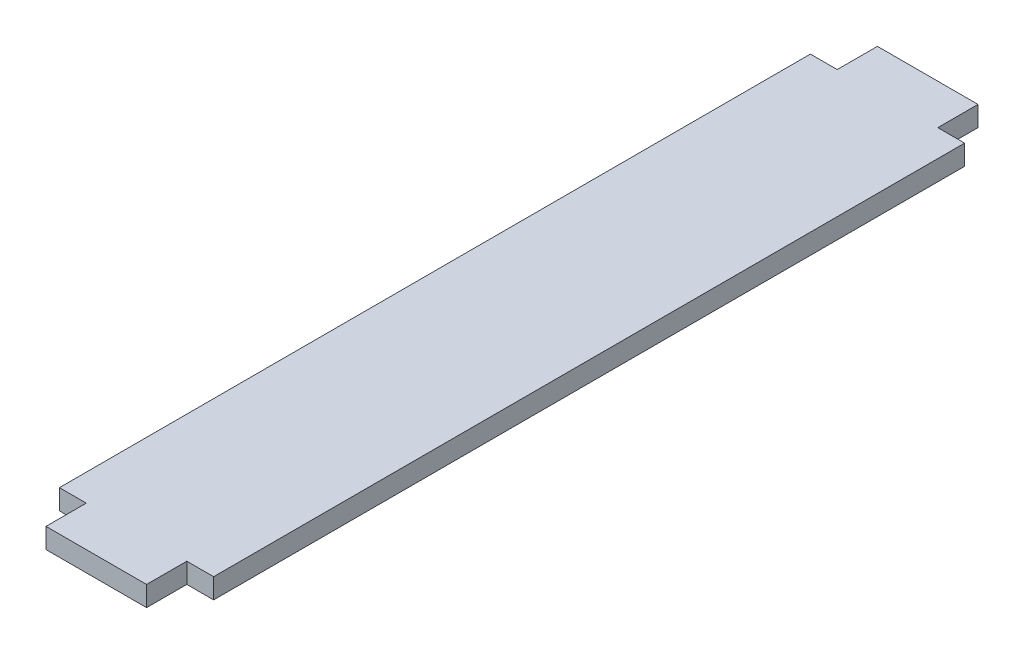
from build123d import *

# Parameters (mm, degrees)
BOSS_EXTRUDE1_DEPTH = 1.5


with BuildPart() as part:
    # Sketch1 → Boss-Extrude1 (new body)
    with BuildSketch(Plane(origin=(0, 0, 0), x_dir=(1, 0, 0), z_dir=(0, 1, 0))):
        Polygon((3.75, 28), (5.75, 28), (5.75, -11.9), (5.75, -13.6), (5.75, -28), (3.75, -28), (3.75, -31), (-3.75, -31), (-3.75, -28), (-5.75, -28), (-5.75, -18.6), (-5.75, -16.9), (-5.75, 28), (-3.75, 28), (-3.75, 31), (3.75, 31), align=None)
    extrude(amount=BOSS_EXTRUDE1_DEPTH)


solid = part.part
